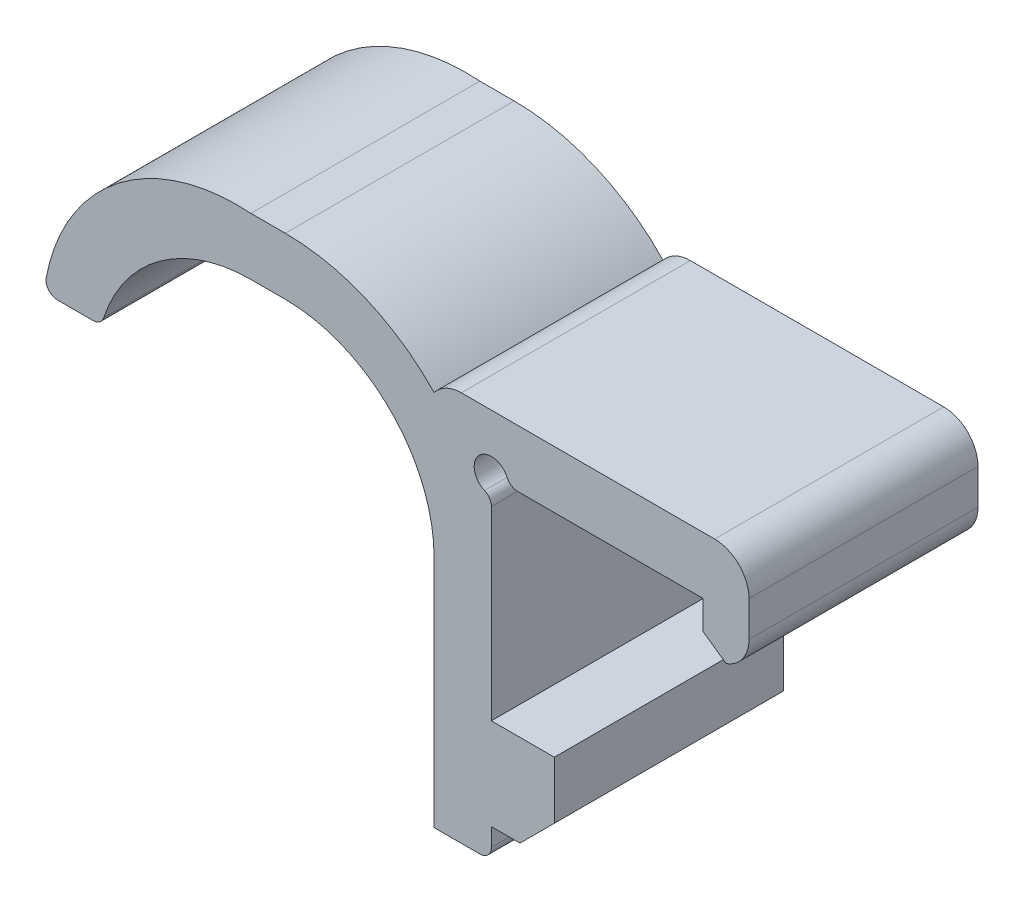
from build123d import *

# Parameters (mm, degrees)
BOSS_EXTRUDE1_DEPTH     = 20
BOSS_EXTRUDE2_DEPTH     = 20
FILLET1_R               = 3
CHAMFER1_SIZE           = 3
FILLET2_R               = 1
CUT_EXTRUDE1_DEPTH      = 71.578127074
CUT_EXTRUDE2_DEPTH      = 2
CUT_EXTRUDE2_DEPTH_BACK = 2
CUT_EXTRUDE2_START      = -10
CHAMFER2_START          = 44.201779004
CHAMFER2_OUTLINE_W      = 6
CHAMFER2_OUTLINE_H      = 20
CHAMFER2_DEPTH          = 1.294789205


with BuildPart() as part:
    # Sketch1 → Boss-Extrude1 (new body)
    with BuildSketch(Plane.XY):
        with BuildLine():
            Line((18, 45.5), (18, 41.407980081))
            Line((18, 41.407980081), (22, 41.407980081))
            Line((22, 41.407980081), (22, 50.5))
            Line((22, 50.5), (-5.5, 50.5))
            Line((-5.5, 50.5), (-5.5, 28.873187411))
            Line((-5.5, 28.873187411), (-5.5, 16.423287813))
            Line((-5.5, 16.423287813), (-0.5, 16.423287813))
            Line((-0.5, 16.423287813), (-0.5, 19))
            Line((-0.5, 19), (5, 19))
            Line((5, 19), (5, 27))
            Line((5, 27), (-0.5, 27))
            Line((-0.5, 27), (-0.5, 44))
            ThreePointArc((-0.5, 44), (-1.560660172, 46.560660172), (1, 45.5))
            Line((1, 45.5), (18, 45.5))
        make_face()
        with BuildLine():
            Line((-5.5, 16.423287813), (-5.5, 28.873187411))
            ThreePointArc((-5.5, 28.873187411), (-9.307611845, 19.680799255), (-18.5, 15.873187411))
            Line((-18.5, 15.873187411), (-21.5, 15.873187411))
            ThreePointArc((-21.5, 15.873187411), (-29.723519433, 18.660367749), (-34.557759664, 25.873187411))
            Line((-34.557759664, 25.873187411), (-39.557759664, 25.873187411))
            ThreePointArc((-39.557759664, 25.873187411), (-33.539294452, 14.749097831), (-21.5, 10.873187411))
            Line((-21.5, 10.873187411), (-18.5, 10.873187411))
            ThreePointArc((-18.5, 10.873187411), (-11.432404679, 12.31875911), (-5.5, 16.423287813))
        make_face()
    extrude(amount=-BOSS_EXTRUDE1_DEPTH)

    # Sketch4 → Boss-Extrude2 (add)
    with BuildSketch(Plane.XY):
        with BuildLine():
            Line((-5.5, 49.330303976), (-5.5, 36.880404378))
            ThreePointArc((-5.5, 36.880404378), (-9.307611845, 46.072792533), (-18.5, 49.880404378))
            Line((-18.5, 49.880404378), (-21.5, 49.880404378))
            ThreePointArc((-21.5, 49.880404378), (-29.723519433, 47.09322404), (-34.557759664, 39.880404378))
            Line((-34.557759664, 39.880404378), (-39.557759664, 39.880404378))
            ThreePointArc((-39.557759664, 39.880404378), (-33.539294452, 51.004493958), (-21.5, 54.880404378))
            Line((-21.5, 54.880404378), (-18.5, 54.880404378))
            ThreePointArc((-18.5, 54.880404378), (-11.432404679, 53.434832679), (-5.5, 49.330303976))
        make_face()
    extrude(amount=-BOSS_EXTRUDE2_DEPTH)

    # Fillet1
    # the kernel refuses this fillet: 3 mm, written as the material it takes off along each edge
    with BuildSketch(Plane(origin=(22, 41.407980081, 7.5), x_dir=(-1, 0, 0), z_dir=(0, 0, -1)), Plane(origin=(22, 50.5, 7.5), x_dir=(0, -1, 0), z_dir=(0, 0, -1))) as fillet1_piece_1:
        with BuildLine():
            CenterArc((FILLET1_R, FILLET1_R), FILLET1_R, 180, 90)
            Line((0, FILLET1_R), (-FILLET1_R * 0.02, FILLET1_R))
            Line((-FILLET1_R * 0.02, FILLET1_R), (-FILLET1_R * 0.02, -FILLET1_R * 0.02))
            Line((-FILLET1_R * 0.02, -FILLET1_R * 0.02), (FILLET1_R, -FILLET1_R * 0.02))
            Line((FILLET1_R, -FILLET1_R * 0.02), (FILLET1_R, 0))
        make_face()
    extrude(amount=35, mode=Mode.SUBTRACT)
    with BuildSketch(Plane(origin=(-5.5, 50.5, 5.942425513), x_dir=(1, 0, 0), z_dir=(0, 0, -1))) as fillet1_piece_2_section:
        with BuildLine():
            CenterArc((2.376970205, 3), FILLET1_R, 217.596829801, 52.403170199)
            Line((0, 1.169696024), (-0.047539404, 1.133089945))
            ThreePointArc((-0.047539404, 1.133089945), (-0.06, 0.584848012), (-0.06, 0))
            Line((-0.06, 0), (0, -0.06))
            Line((0, -0.06), (2.376970205, -0.06))
            Line((2.376970205, -0.06), (2.376970205, 0))
        make_face()
    fillet1_piece_2 = extrude(amount=31.884851026, mode=Mode.PRIVATE)
    fillet1_piece_2 = fillet1_piece_2 - Plane(origin=(-18.5, 36.880404378, 5.942425513), x_dir=(0, 1, 0), z_dir=(0, 0, 1)) * Cylinder(18, 74, mode=Mode.PRIVATE)
    add(fillet1_piece_2, mode=Mode.SUBTRACT)

    # Chamfer1
    chamfer1_edges = [part.edges().sort_by_distance(p)[0] for p in [
        (5, 19, -10),
    ]]
    chamfer(chamfer1_edges, length=CHAMFER1_SIZE)

    # Fillet2
    fillet2_edges = [part.edges().sort_by_distance(p)[0] for p in [
        (-0.5, 16.423287813, -10),
        (1, 45.5, -10),
        (-0.5, 44, -10),
        (-34.557759664, 39.880404378, -10),
        (-39.557759664, 39.880404378, -10),
    ]]
    fillet(fillet2_edges, radius=FILLET2_R)

    # Sketch1<3> → Cut-Extrude1 (cut, through all)
    with BuildSketch(Plane.XY):
        with BuildLine():
            Line((-34.557759664, 25.873187411), (-39.557759664, 25.873187411))
            ThreePointArc((-39.557759664, 25.873187411), (-33.539294452, 14.749097831), (-21.5, 10.873187411))
            Line((-21.5, 10.873187411), (-18.5, 10.873187411))
            ThreePointArc((-18.5, 10.873187411), (-11.432404679, 12.31875911), (-5.5, 16.423287813))
            Line((-5.5, 16.423287813), (-5.5, 28.873187411))
            ThreePointArc((-5.5, 28.873187411), (-9.307611845, 19.680799255), (-18.5, 15.873187411))
            Line((-18.5, 15.873187411), (-21.5, 15.873187411))
            ThreePointArc((-21.5, 15.873187411), (-29.723519433, 18.660367749), (-34.557759664, 25.873187411))
        make_face()
    extrude(amount=-CUT_EXTRUDE1_DEPTH, mode=Mode.SUBTRACT)

    # Sketch3 → Cut-Extrude2 (cut, two sides: drawn at the far end of the back side and taken through both)
    with BuildSketch(Plane.XY.offset(CUT_EXTRUDE2_START - CUT_EXTRUDE2_DEPTH_BACK)):
        with BuildLine():
            ThreePointArc((-10.615862632, 48.696779185), (-12.77767622, 49.881994518), (-15.111856664, 50.675578184))
            Line((-15.111856664, 50.675578184), (-14.837502866, 49.3538207))
            ThreePointArc((-14.837502866, 49.3538207), (-12.420426421, 48.371217451), (-10.248251304, 46.925733813))
            Line((-10.248251304, 46.925733813), (-10.615862632, 48.696779185))
        make_face()
        with BuildLine():
            ThreePointArc((-4.45647435, 39.017159612), (-5.14675526, 41.725731045), (-6.354052632, 44.246699113))
            Line((-6.354052632, 44.246699113), (-6.995300859, 42.933659509))
            ThreePointArc((-6.995300859, 42.933659509), (-5.87936038, 39.99800852), (-5.5, 36.880404378))
            Line((-5.5, 36.880404378), (-4.45647435, 39.017159612))
        make_face()
        with BuildLine():
            ThreePointArc((-21.5, 53.034307539), (-31.973681851, 49.335761876), (-37.80235804, 39.880404378))
            Line((-37.80235804, 39.880404378), (-35.80235804, 39.880404378))
            ThreePointArc((-35.80235804, 39.880404378), (-30.584504262, 47.950694244), (-21.5, 51.085556106))
            Line((-21.5, 51.085556106), (-18.5, 51.085556106))
            ThreePointArc((-18.5, 51.085556106), (-16.793571188, 50.982689168), (-15.111856664, 50.675578184))
            ThreePointArc((-15.111856664, 50.675578184), (-12.77767622, 49.881994518), (-10.615862632, 48.696779185))
            ThreePointArc((-10.615862632, 48.696779185), (-8.240766267, 46.705599481), (-6.354052632, 44.246699113))
            ThreePointArc((-6.354052632, 44.246699113), (-5.14675526, 41.725731045), (-4.45647435, 39.017159612))
            ThreePointArc((-4.45647435, 39.017159612), (-4.418325892, 35.011503653), (-5.5, 31.15446903))
            Line((-5.5, 31.15446903), (-5.5, 28.873187411))
            Line((-5.5, 28.873187411), (-5.5, 27.291421776))
            ThreePointArc((-5.5, 27.291421776), (-4.080428513, 44.162199863), (-18.5, 53.034307539))
            Line((-18.5, 53.034307539), (-21.5, 53.034307539))
        make_face()
    extrude(amount=CUT_EXTRUDE2_DEPTH + CUT_EXTRUDE2_DEPTH_BACK, mode=Mode.SUBTRACT)

    # Chamfer2: read off the stored shape, not the designer's step
    # Chamfer2 outline → Chamfer2 (cut)
    with BuildSketch(Plane(origin=(0, 0, 0), x_dir=(0.8164965809277286, -0.5773502691896223, 0), z_dir=(0.5773502691896223, 0.8164965809277285, 0)).offset(CHAMFER2_START)):
        with Locations((-9, 10)):
            Rectangle(CHAMFER2_OUTLINE_W, CHAMFER2_OUTLINE_H)
    extrude(amount=CHAMFER2_DEPTH, mode=Mode.SUBTRACT)


solid = part.part
